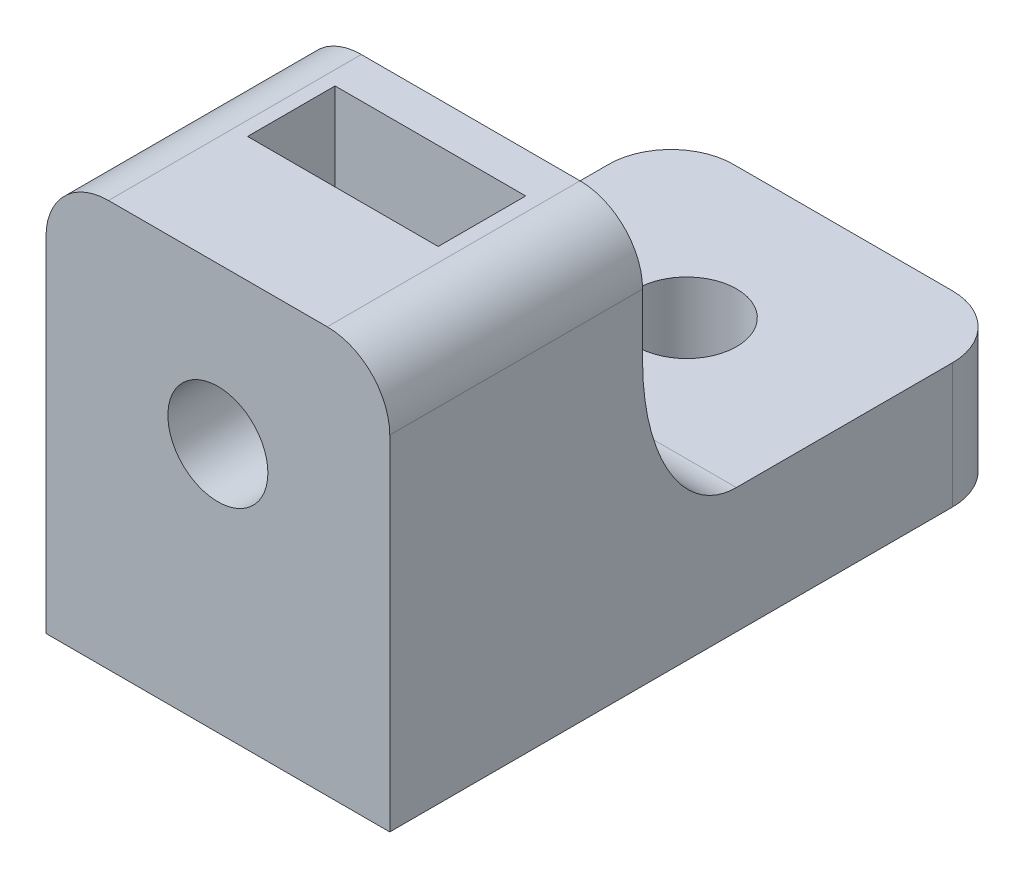
from build123d import *

# Parameters (mm, degrees)
SKETCH1_W                   = 11
SKETCH1_H                   = 20
BASE_DEPTH                  = 4
SKETCH1_3_W                 = 11
SKETCH1_3_H                 = 8.089952371
SKETCH1_3_W_2               = 6.1
SKETCH1_3_H_2               = 2.8
VERTICALPIECE_DEPTH         = 13
FILLETCORNER_SIZE           = 3
FILLETCORNER_SIZE_2         = 5
F_3_2_3_2_HORIZONTAL_HOLE_D = 3.2
F_3_2_3_2_VERTICAL_HOLE_D   = 3.2
SKETCH1_4_W                 = 6.1
SKETCH1_4_H                 = 2.8
NUTSLOT_DEPTH               = 4.8
FILLET2_R                   = 2


with BuildPart() as part:
    # Sketch1 → Base (new body)
    with BuildSketch(Plane(origin=(0, 0, 0), x_dir=(1, 0, 0), z_dir=(0, 1, 0))):
        with Locations((0, 10)):
            Rectangle(SKETCH1_W, SKETCH1_H)
    extrude(amount=BASE_DEPTH)

    # Sketch1<3> → VerticalPiece (add)
    with BuildSketch(Plane(origin=(0, 0, 0), x_dir=(1, 0, 0), z_dir=(0, 1, 0))):
        with Locations((0, 4.044976186)):
            Rectangle(SKETCH1_3_W, SKETCH1_3_H)
        with Locations((0, 5.4)):
            Rectangle(SKETCH1_3_W_2, SKETCH1_3_H_2, mode=Mode.SUBTRACT)
    extrude(amount=VERTICALPIECE_DEPTH)

    # FilletCorner
    # an asymmetric fillet: 5, 3 mm, written as the material it adds along each edge
    with BuildSketch(Plane(origin=(-5.5, 4, -8.089952371), x_dir=(0, 0, -1), z_dir=(1, 0, 0))) as filletcorner_piece_1:
        with BuildLine():
            Bezier((FILLETCORNER_SIZE, 0), (0, 0), (0, FILLETCORNER_SIZE_2), weights=[1, 0.707106781, 1])
            Line((0, FILLETCORNER_SIZE_2), (0, 0))
            Line((0, 0), (FILLETCORNER_SIZE, 0))
        make_face()
    extrude(amount=11)

    # Ø3.2 (3.2) Horizontal Hole (through all)
    with Locations(Plane(origin=(0, 0, 0), x_dir=(-1, 0, 0), z_dir=(0, -1, 0))):
        with Locations((0, 15)):
            Hole(F_3_2_3_2_HORIZONTAL_HOLE_D / 2)

    # Ø3.2 (3.2) Vertical Hole (through all)
    with Locations(Plane.XY):
        with Locations((0, 8)):
            Hole(F_3_2_3_2_VERTICAL_HOLE_D / 2)

    # Sketch1<4> → NutSlot (add)
    with BuildSketch(Plane(origin=(0, 0, 0), x_dir=(1, 0, 0), z_dir=(0, 1, 0))):
        with Locations((0, 5.4)):
            Rectangle(SKETCH1_4_W, SKETCH1_4_H)
    extrude(amount=NUTSLOT_DEPTH)

    # Fillet2
    fillet2_edges = [part.edges().sort_by_distance(p)[0] for p in [
        (5.5, 2, -20),
        (-5.5, 2, -20),
        (-5.5, 13, -4.044976185),
        (5.5, 13, -4.044976185),
    ]]
    fillet(fillet2_edges, radius=FILLET2_R)


solid = part.part
